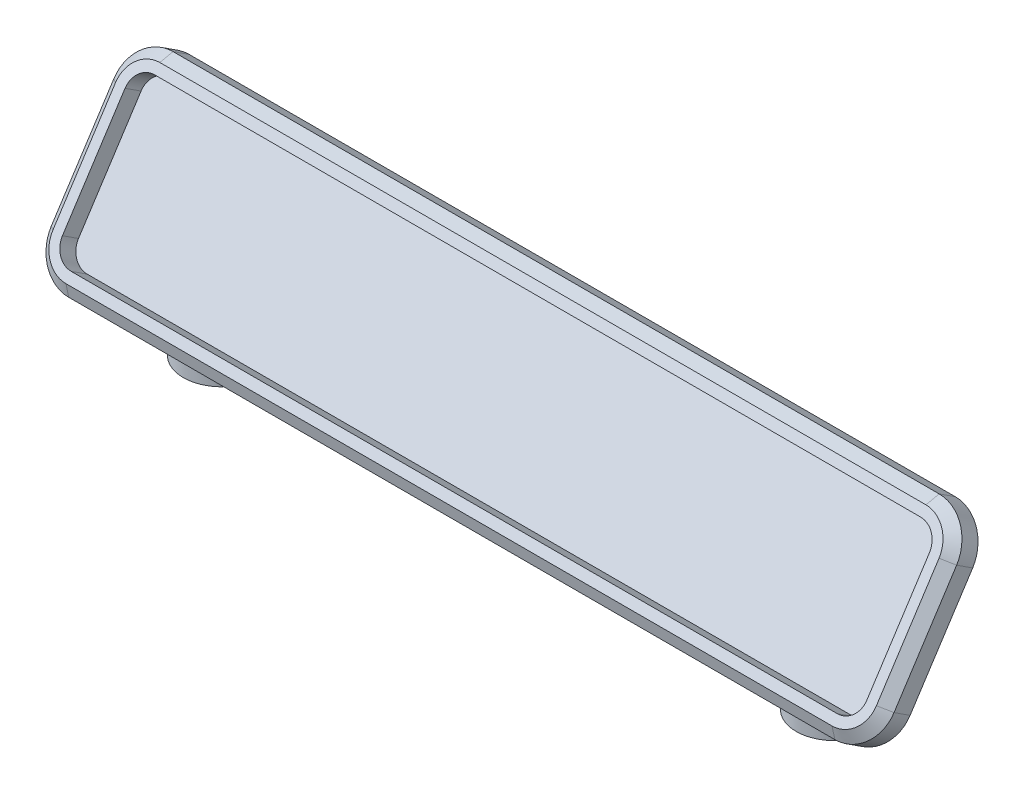
from build123d import *

# Parameters (mm, degrees)
SKETCH2_R             = 6.35
BOSS_EXTRUDE1_DEPTH   = 19.05
BOSS_EXTRUDE1_2_DEPTH = 19.05
BOSS_EXTRUDE2_DEPTH   = 6.35
BOSS_EXTRUDE3_REACH   = 75.737
CUT_EXTRUDE1_DEPTH    = 3.175
CHAMFER2_SIZE         = 1.5875
HOLE1_D               = 5.08
HOLE1_DEPTH           = 10.16
HOLE1_CBORE_D         = 6.35
HOLE1_CBORE_DEPTH     = 0.6858


with BuildPart() as part:
    # Sketch2 → Boss-Extrude1 (new body)
    with BuildSketch(Plane(origin=(0, 0, 0), x_dir=(1, 0, 0), z_dir=(0, 1, 0))):
        with Locations((-50.8, 0)):
            Circle(SKETCH2_R)
    extrude(amount=BOSS_EXTRUDE1_DEPTH)



with BuildPart() as body_2:
    # Sketch2 → Boss-Extrude1 2 (new body)
    with BuildSketch(Plane(origin=(0, 0, 0), x_dir=(1, 0, 0), z_dir=(0, 1, 0))):
        with Locations((50.8, 0)):
            Circle(SKETCH2_R)
    extrude(amount=BOSS_EXTRUDE1_2_DEPTH)


with BuildPart() as part_1:
    add(part.part)

    add(body_2.part)  # Boss-Extrude2 merges body 2
    # Sketch3 → Boss-Extrude2 (add)
    with BuildSketch(Plane(origin=(0, 5.650833475, 8.701520484), x_dir=(-1, 0, 0), z_dir=(0, 0.5446390350150281, 0.8386705679454234))):
        with BuildLine():
            ThreePointArc((-69.85, -25.501674319), (-67.990128061, -29.99180238), (-63.5, -31.851674319))
            Line((-63.5, -31.851674319), (63.5, -31.851674319))
            ThreePointArc((63.5, -31.851674319), (67.990128061, -29.99180238), (69.85, -25.501674319))
            Line((69.85, -25.501674319), (69.85, -6.451674319))
            ThreePointArc((69.85, -6.451674319), (67.990128061, -1.961546259), (63.5, -0.101674319))
            Line((63.5, -0.101674319), (-63.5, -0.101674319))
            ThreePointArc((-63.5, -0.101674319), (-67.990128061, -1.961546259), (-69.85, -6.451674319))
            Line((-69.85, -6.451674319), (-69.85, -25.501674319))
        make_face()
    extrude(amount=BOSS_EXTRUDE2_DEPTH)

    # Sketch8 → Boss-Extrude3 (add, up to next)
    with BuildSketch(Plane(origin=(0, 19.05, 0), x_dir=(1, 0, 0), z_dir=(0, 1, 0)), mode=Mode.PRIVATE) as boss_extrude3_sk1:
        with BuildLine():
            ThreePointArc((57.15, 0), (50.8, 6.35), (44.45, 0))
            Line((44.45, 0), (57.15, 0))
        make_face()
    boss_extrude3_tool1 = extrude(boss_extrude3_sk1.sketch, amount=BOSS_EXTRUDE3_REACH, mode=Mode.PRIVATE) - part_1.part
    # Sketch8 → Boss-Extrude3 (add, up to next)
    with BuildSketch(Plane(origin=(0, 19.05, 0), x_dir=(1, 0, 0), z_dir=(0, 1, 0)), mode=Mode.PRIVATE) as boss_extrude3_sk2:
        with BuildLine():
            ThreePointArc((-44.45, 0), (-50.8, 6.35), (-57.15, 0))
            Line((-57.15, 0), (-44.45, 0))
        make_face()
    boss_extrude3_tool2 = extrude(boss_extrude3_sk2.sketch, amount=BOSS_EXTRUDE3_REACH, mode=Mode.PRIVATE) - part_1.part
    add(boss_extrude3_tool1.solids().sort_by_distance((50.8, 19.05, -2.695024))[0])
    add(boss_extrude3_tool2.solids().sort_by_distance((-50.8, 19.05, -2.695024))[0])

    # Sketch9 → Cut-Extrude1 (cut)
    with BuildSketch(Plane(origin=(0, 9.109291347, 14.02707859), x_dir=(1, 0, 0), z_dir=(0, 0.5446390350150282, 0.8386705679454234))):
        with BuildLine():
            Line((63.5, 28.676674319), (-63.5, 28.676674319))
            ThreePointArc((-63.5, 28.676674319), (-65.74506403, 27.74673835), (-66.675, 25.501674319))
            Line((-66.675, 25.501674319), (-66.675, 6.451674319))
            ThreePointArc((-66.675, 6.451674319), (-65.74506403, 4.206610289), (-63.5, 3.276674319))
            Line((-63.5, 3.276674319), (63.5, 3.276674319))
            ThreePointArc((63.5, 3.276674319), (65.74506403, 4.206610289), (66.675, 6.451674319))
            Line((66.675, 6.451674319), (66.675, 25.501674319))
            ThreePointArc((66.675, 25.501674319), (65.74506403, 27.74673835), (63.5, 28.676674319))
        make_face()
    extrude(amount=-CUT_EXTRUDE1_DEPTH, mode=Mode.SUBTRACT)

    # Chamfer2
    chamfer2_edges = [part_1.edges().sort_by_distance(p)[0] for p in [
        (-69.85, 19.05, 0),
        (0, 32.363895266, -8.646144681),
        (69.85, 19.05, 0),
        (0, 5.736104734, 8.646144681),
        (0, 9.194562606, 13.971702787),
        (-69.85, 22.508457872, 5.325558106),
        (69.85, 22.508457872, 5.325558106),
        (0, 35.822353138, -3.320586574),
        (67.990128061, 30.80407541, -7.633185823),
        (-67.990128061, 30.80407541, -7.633185823),
        (67.990128061, 7.29592459, 7.633185823),
        (-67.990128061, 7.29592459, 7.633185823),
        (67.990128061, 10.754382462, 12.958743929),
        (-67.990128061, 10.754382462, 12.958743929),
        (67.990128061, 34.262533283, -2.307627716),
        (-67.990128061, 34.262533283, -2.307627716),
    ]]
    chamfer(chamfer2_edges, length=CHAMFER2_SIZE)

    # Hole1
    with Locations(Plane(origin=(-50.8, 0, 0), x_dir=(0, 0, -1), z_dir=(0, -1, 0))):
        with Locations((0, 0), (0, 101.6)):
            CounterBoreHole(HOLE1_D / 2, HOLE1_CBORE_D / 2, HOLE1_CBORE_DEPTH, depth=HOLE1_DEPTH)


solid = part_1.part
